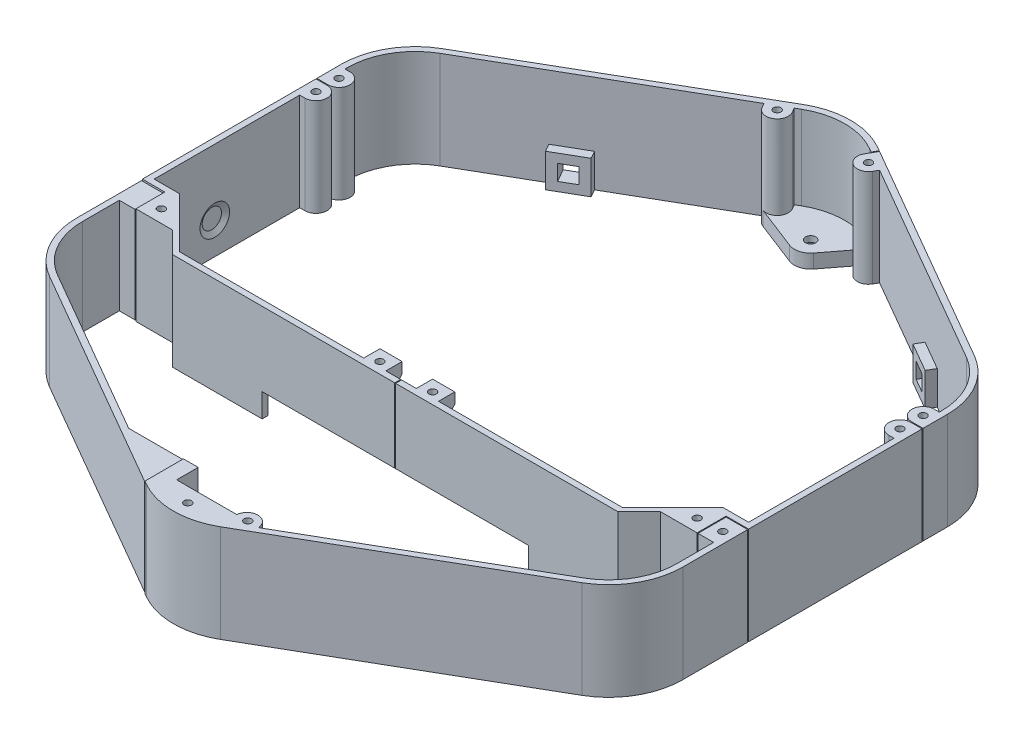
from build123d import *

# Parameters (mm, degrees)
BOSS_EXTRU_1_DEPTH       = 33
CONG_8_R                 = 25
ENL_V_MAT_EXTRU_8_DEPTH  = 158.17203288
ESQUISSE32_R             = 5
ENL_V_MAT_EXTRU_17_DEPTH = 1
CHANFREIN1_SIZE2         = 1.732050808
CHANFREIN1_SIZE          = 1
CHANFREIN2_SIZE2         = 1.732050808
CHANFREIN2_SIZE          = 1
BOSS_EXTRU_2_DEPTH       = 33
BOSS_EXTRU_3_START       = -33
ESQUISSE34_W             = 18.5
ESQUISSE34_H             = 9.8
BOSS_EXTRU_3_DEPTH       = 33
ESQUISSE35_W             = 0.3
ESQUISSE35_H             = 13
ENL_V_MAT_EXTRU_22_DEPTH = 158.17203288
ESQUISSE36_W             = 17.253866082
ESQUISSE36_H             = 7.3
ENL_V_MAT_EXTRU_23_DEPTH = 158.17203288
ENL_V_START              = -15.2
ESQUISSE37_W             = 5.5
ESQUISSE37_H             = 5.5
ENL_V_MAT_EXTRU_24_DEPTH = 20.5
ENL_V_START_2            = -5.3
ESQUISSE38_W             = 5.5
ESQUISSE38_H             = 5.5
ENL_V_MAT_EXTRU_25_DEPTH = 10.6
ESQUISSE39_W             = 228.978583448
ESQUISSE39_H             = 0.3
ENL_V_MAT_EXTRU_26_DEPTH = 158.17203288
ENL_V_MAT_EXTRU_27_DEPTH = 158.17203288
BOSS_EXTRU_4_DEPTH       = 33
ENL_V_MAT_EXTRU_28_DEPTH = 158.17203288
BOSS_EXTRU_5_DEPTH       = 4.7
ENL_V_MAT_EXTRU_29_DEPTH = 2.7
ESQUISSE45_R             = 1.75
ENL_V_MAT_EXTRU_30_DEPTH = 157.627385599
CONG_10_R                = 8
ESQUISSE46_W             = 90
ESQUISSE46_H             = 8
ENL_V_MAT_EXTRU_31_DEPTH = 2
ESQUISSE47_W             = 0.3
ESQUISSE47_H             = 2
ESQUISSE47_W_2           = 205
ESQUISSE47_H_2           = 0.3
ENL_V_MAT_EXTRU_32_DEPTH = 158.17203288
ENL_V_MAT_EXTRU_33_DEPTH = 158.17203288
BOSS_EXTRU_6_START       = -33
ESQUISSE49_R             = 3.75
ESQUISSE49_R_2           = 1.25
BOSS_EXTRU_6_DEPTH       = 33
BOSS_EXTRU_7_DEPTH       = 4.7
ESQUISSE51_R             = 1.25
ENL_V_MAT_EXTRU_34_DEPTH = 158.17203288
ESQUISSE52_W             = 7.5
ESQUISSE52_H             = 7.5
BOSS_EXTRU_8_DEPTH       = 25
ESQUISSE53_R             = 1.25
ENL_V_MAT_EXTRU_35_DEPTH = 158.17203288
ENL_V_MAT_EXTRU_36_REACH = 167.699
BOSS_EXTRU_9_DEPTH       = 4.7
ESQUISSE56_W             = 5.3
ESQUISSE56_H             = 5.3
ENL_V_MAT_EXTRU_37_DEPTH = 13
ESQUISSE57_W             = 11.3
ESQUISSE57_H             = 11.3
ESQUISSE57_W_2           = 5.3
ESQUISSE57_H_2           = 5.3
BOSS_EXTRU_10_DEPTH      = 3
ESQUISSE58_W             = 5.3
ESQUISSE58_H             = 5.3
ENL_V_MAT_EXTRU_38_DEPTH = 2
ESQUISSE59_W             = 11.3
ESQUISSE59_H             = 11.3
ESQUISSE59_W_2           = 5.3
ESQUISSE59_H_2           = 5.3
BOSS_EXTRU_11_DEPTH      = 3


with BuildPart() as part:
    # Esquisse1 → Boss.-Extru.1 (new body)
    with BuildSketch(Plane(origin=(0, 0, 0), x_dir=(1, 0, 0), z_dir=(0, 1, 0))):
        Polygon((-102.5, 59.178402592), (-102.5, -59.178402592), (0, -118.356805184), (102.5, -59.178402592), (102.5, 59.178402592), (0, 118.356805184), align=None)
    extrude(amount=BOSS_EXTRU_1_DEPTH)

    # Congé8
    cong_8_edges = [part.edges().sort_by_distance(p)[0] for p in [
        (0, 16.5, -118.356805184),
        (102.5, 16.5, -59.178402592),
        (102.5, 16.5, 59.178402592),
        (0, 16.5, 118.356805184),
        (-102.5, 16.5, 59.178402592),
        (-102.5, 16.5, -59.178402592),
    ]]
    fillet(cong_8_edges, radius=CONG_8_R)

    # Esquisse22 → Enlèv. mat.-Extru.8 (cut, through all)
    with BuildSketch(Plane(origin=(0, 33, 0), x_dir=(1, 0, 0), z_dir=(0, 1, 0))):
        with BuildLine():
            Line((89, 64.663230149), (11.5, 109.407876011))
            ThreePointArc((11.5, 109.407876011), (0, 112.489291724), (-11.5, 109.407876011))
            Line((-11.5, 109.407876011), (-89, 64.663230149))
            ThreePointArc((-89, 64.663230149), (-97.418584287, 56.244645862), (-100.5, 44.744645862))
            Line((-100.5, 44.744645862), (-100.5, -44.744645862))
            ThreePointArc((-100.5, -44.744645862), (-97.418584287, -56.244645862), (-89, -64.663230149))
            Line((-89, -64.663230149), (-11.5, -109.407876011))
            ThreePointArc((-11.5, -109.407876011), (0, -112.489291724), (11.5, -109.407876011))
            Line((11.5, -109.407876011), (89, -64.663230149))
            ThreePointArc((89, -64.663230149), (97.418584287, -56.244645862), (100.5, -44.744645862))
            Line((100.5, -44.744645862), (100.5, 44.744645862))
            ThreePointArc((100.5, 44.744645862), (97.418584287, 56.244645862), (89, 64.663230149))
        make_face()
    extrude(amount=-ENL_V_MAT_EXTRU_8_DEPTH, mode=Mode.SUBTRACT)

    # Esquisse32 → Enlèv. mat.-Extru.17 (cut)
    with BuildSketch(Plane(origin=(-100.5, 0, 0), x_dir=(0, 0, -1), z_dir=(1, 0, 0))):
        with Locations((0, 10.7)):
            Circle(ESQUISSE32_R)
    enl_v_mat_extru_17 = extrude(amount=-ENL_V_MAT_EXTRU_17_DEPTH, mode=Mode.SUBTRACT)

    # Chanfrein1
    chanfrein1_edges = [part.edges().sort_by_distance(p)[0] for p in [
        (-101.5, 10.7, 5),
    ]]
    chanfrein1_side = [part.faces().sort_by_distance(p)[0] for p in [
        (-101.48, 10.7, 5),
    ]]
    chamfer(chanfrein1_edges, length=CHANFREIN1_SIZE - 0.0001, length2=CHANFREIN1_SIZE2 - 0.0001, reference=chanfrein1_side[0])  # a hair under: the kernel refuses the full size

    # Symétrie8: Enlèv. mat.-Extru.17 across plane
    add(enl_v_mat_extru_17.mirror(Plane(origin=(0, 0, 0), x_dir=(0, 0, 1), z_dir=(1, 0, 0))), mode=Mode.SUBTRACT)

    # Chanfrein2
    chanfrein2_edges = [part.edges().sort_by_distance(p)[0] for p in [
        (101.5, 10.7, 5),
    ]]
    chanfrein2_side = [part.faces().sort_by_distance(p)[0] for p in [
        (101.48, 10.7, 5),
    ]]
    chamfer(chanfrein2_edges, length=CHANFREIN2_SIZE - 0.0001, length2=CHANFREIN2_SIZE2 - 0.0001, reference=chanfrein2_side[0])  # a hair under: the kernel refuses the full size

    # Esquisse33 → Boss.-Extru.2 (add)
    with BuildSketch(Plane.XZ):
        Polygon((-100.5, 20.5), (-80, 20.5), (-80, 32.5), (-75, 37.5), (75, 37.5), (80, 32.5), (80, 20.5), (100.5, 20.5), (100.5, 22.5), (82, 22.5), (82, 32.828427125), (75.328427125, 39.5), (-75.328427125, 39.5), (-82, 32.828427125), (-82, 22.5), (-100.5, 22.5), align=None)
    extrude(amount=-BOSS_EXTRU_2_DEPTH)

    # Esquisse34 → Boss.-Extru.3 (add)
    with BuildSketch(Plane.XZ.offset(BOSS_EXTRU_3_START)):
        with Locations((-91.25, 27.4)):
            Rectangle(ESQUISSE34_W, ESQUISSE34_H)
        with BuildLine():
            Line((11.5, 109.407876011), (32.143593539, 97.489291724))
            Line((32.143593539, 97.489291724), (-32.143593539, 97.489291724))
            Line((-32.143593539, 97.489291724), (-11.5, 109.407876011))
            ThreePointArc((-11.5, 109.407876011), (0, 112.489291724), (11.5, 109.407876011))
        make_face()
        with Locations((91.25, 27.4)):
            Rectangle(ESQUISSE34_W, ESQUISSE34_H)
    extrude(amount=BOSS_EXTRU_3_DEPTH)

    # Esquisse35 → Enlèv. mat.-Extru.22 (cut, through all)
    with BuildSketch(Plane(origin=(0, 0, 0), x_dir=(1, 0, 0), z_dir=(0, 1, 0))):
        Polygon((-102.5, -22.5), (-94.9, -22.5), (-94.9, -32.3), (-95.2, -32.3), (-95.2, -22.8), (-102.5, -22.8), align=None)
        with Locations((-13.776933041, -103.989291724)):
            Rectangle(ESQUISSE35_W, ESQUISSE35_H)
    extrude(amount=ENL_V_MAT_EXTRU_22_DEPTH, mode=Mode.SUBTRACT)


with BuildPart() as enl_v_mat_extru_22_piece_1:
    # of the separate pieces the step leaves, piece 1, a body of its own (enl_v_mat_extru_22_pieces)
    add(part.part.solids().sort_by_distance((100.5001, 10.7, -5))[0])

    # Esquisse36 → Enlèv. mat.-Extru.23 (cut, through all)
    with BuildSketch(Plane.XZ):
        with Locations((0, 101.139291724)):
            Rectangle(ESQUISSE36_W, ESQUISSE36_H)
    extrude(amount=-ENL_V_MAT_EXTRU_23_DEPTH, mode=Mode.SUBTRACT)


with BuildPart() as enl_v_mat_extru_22_piece_2:
    # of the separate pieces the step leaves, piece 2, a body of its own (enl_v_mat_extru_22_pieces)
    add(part.part.solids().sort_by_distance((-102.5, 33, 22.8))[0])


with BuildPart() as enl_v_mat_extru_24_tool:
    # Esquisse37 → Enlèv. mat.-Extru.24 (new body)
    with BuildSketch(Plane.ZY.offset(95.2).offset(ENL_V_START)):
        with Locations((27.55, 16.5)):
            Rectangle(ESQUISSE37_W, ESQUISSE37_H)
    extrude(amount=ENL_V_MAT_EXTRU_24_DEPTH)


with BuildPart() as enl_v_mat_extru_22_piece_1_1:
    add(enl_v_mat_extru_22_piece_1.part)

    # Enlèv. mat.-Extru.24: cut by enl_v_mat_extru_24_tool
    add(enl_v_mat_extru_24_tool.part, mode=Mode.SUBTRACT)


with BuildPart() as enl_v_mat_extru_22_piece_2_1:
    add(enl_v_mat_extru_22_piece_2.part)

    # Enlèv. mat.-Extru.24: cut by enl_v_mat_extru_24_tool
    add(enl_v_mat_extru_24_tool.part, mode=Mode.SUBTRACT)


with BuildPart() as enl_v_mat_extru_25_tool:
    # Esquisse38 → Enlèv. mat.-Extru.25 (new body)
    with BuildSketch(Plane(origin=(-13.926933041, 0, 0), x_dir=(0, 0, -1), z_dir=(1, 0, 0)).offset(ENL_V_START_2)):
        with Locations((-102.039291724, 16.5)):
            Rectangle(ESQUISSE38_W, ESQUISSE38_H)
    extrude(amount=ENL_V_MAT_EXTRU_25_DEPTH)


with BuildPart() as enl_v_mat_extru_22_piece_1_2:
    add(enl_v_mat_extru_22_piece_1_1.part)

    # Enlèv. mat.-Extru.25: cut by enl_v_mat_extru_25_tool
    add(enl_v_mat_extru_25_tool.part, mode=Mode.SUBTRACT)

    # Esquisse40 → Enlèv. mat.-Extru.27 (cut, through all)
    with BuildSketch(Plane(origin=(0, 33, 0), x_dir=(1, 0, 0), z_dir=(0, 1, 0))):
        Polygon((32.143593539, -97.489291724), (19.499622644, -104.789291724), (8.626933041, -104.789291724), (8.626933041, -97.489291724), align=None)
    extrude(amount=-ENL_V_MAT_EXTRU_27_DEPTH, mode=Mode.SUBTRACT)

    # Esquisse41 → Boss.-Extru.4 (add)
    with BuildSketch(Plane(origin=(0, 33, 0), x_dir=(1, 0, 0), z_dir=(0, 1, 0))):
        Polygon((-82, -32.828427125), (-82.528427125, -32.3), (-82, -32.3), align=None)
        Polygon((82, -32.3), (82, -32.828427125), (82.528427125, -32.3), align=None)
    extrude(amount=-BOSS_EXTRU_4_DEPTH)

    # Esquisse42 → Enlèv. mat.-Extru.28 (cut, through all)
    with BuildSketch(Plane(origin=(0, 33, 0), x_dir=(1, 0, 0), z_dir=(0, 1, 0))):
        Polygon((-80, -32.5), (-92, -20.5), (-80, -20.5), align=None)
        Polygon((80, -20.5), (80, -32.5), (92, -20.5), align=None)
    extrude(amount=-ENL_V_MAT_EXTRU_28_DEPTH, mode=Mode.SUBTRACT)

    # Esquisse43 → Boss.-Extru.5 (add)
    with BuildSketch(Plane(origin=(0, 0, 0), x_dir=(-1, 0, 0), z_dir=(0, -1, 0))):
        with BuildLine():
            Line((-8.688641212, -104.789291724), (8.626933041, -104.789291724))
            Line((8.626933041, -104.789291724), (8.626933041, -97.489291724))
            Line((8.626933041, -97.489291724), (1.335205168, -95.664531215))
            ThreePointArc((1.335205168, -95.664531215), (-2.103871642, -95.918295157), (-4.715890745, -98.169739503))
            Line((-4.715890745, -98.169739503), (-8.688641212, -104.789291724))
        make_face()
        with BuildLine():
            Line((-4.363443372, 97.65181214), (-12.805729024, 108.654013008))
            Line((-12.805729024, 108.654013008), (-11.5, 109.407876011))
            ThreePointArc((-11.5, 109.407876011), (0, 112.489291724), (11.5, 109.407876011))
            Line((11.5, 109.407876011), (12.805729024, 108.654013008))
            Line((12.805729024, 108.654013008), (4.363443372, 97.65181214))
            ThreePointArc((4.363443372, 97.65181214), (0, 95.5), (-4.363443372, 97.65181214))
        make_face()
    extrude(amount=-BOSS_EXTRU_5_DEPTH)

    # Esquisse44 → Enlèv. mat.-Extru.29 (cut)
    with BuildSketch(Plane.XZ):
        Polygon((-1.674315781, -103.9), (1.674315781, -103.9), (3.348631561, -101), (1.674315781, -98.1), (-1.674315781, -98.1), (-3.348631561, -101), align=None)
        Polygon((-3.348631561, 101), (-1.674315781, 103.9), (1.674315781, 103.9), (3.348631561, 101), (1.674315781, 98.1), (-1.674315781, 98.1), align=None)
    extrude(amount=-ENL_V_MAT_EXTRU_29_DEPTH, mode=Mode.SUBTRACT)

    # Esquisse45 → Enlèv. mat.-Extru.30 (cut, through all)
    with BuildSketch(Plane.XZ.offset(-2.7)):
        with Locations(Location((0, -101, 0), (0, 0, 270))):
            Circle(ESQUISSE45_R)
        with Locations(Location((0, 101, 0), (0, 0, 270))):
            Circle(ESQUISSE45_R)
    extrude(amount=-ENL_V_MAT_EXTRU_30_DEPTH, mode=Mode.SUBTRACT)

    # Congé10
    cong_10_edges = [enl_v_mat_extru_22_piece_1_2.edges().sort_by_distance(p)[0] for p in [
        (-8.626933041, 2.35, 97.489291724),
        (8.688641212, 2.35, 104.789291724),
    ]]
    fillet(cong_10_edges, radius=CONG_10_R)

    # Esquisse46 → Enlèv. mat.-Extru.31 (cut)
    with BuildSketch(Plane(origin=(0, 0, 37.5), x_dir=(-1, 0, 0), z_dir=(0, 0, -1))):
        with Locations((0, 4)):
            Rectangle(ESQUISSE46_W, ESQUISSE46_H)
    extrude(amount=-ENL_V_MAT_EXTRU_31_DEPTH, mode=Mode.SUBTRACT)

    # Esquisse47 → Enlèv. mat.-Extru.32 (cut, through all)
    with BuildSketch(Plane(origin=(0, 33, 0), x_dir=(1, 0, 0), z_dir=(0, 1, 0))):
        Polygon((12.805729024, 108.654013008), (13.805729024, 110.386063815), (14.065536645, 110.236063815), (13.065536645, 108.504013008), align=None)
        with Locations((0, -38.5)):
            Rectangle(ESQUISSE47_W, ESQUISSE47_H)
        with Locations((0, 36.35)):
            Rectangle(ESQUISSE47_W_2, ESQUISSE47_H_2)
    extrude(amount=-ENL_V_MAT_EXTRU_32_DEPTH, mode=Mode.SUBTRACT)


with BuildPart() as enl_v_mat_extru_22_piece_2_2:
    add(enl_v_mat_extru_22_piece_2_1.part)

    # Enlèv. mat.-Extru.25: cut by enl_v_mat_extru_25_tool
    add(enl_v_mat_extru_25_tool.part, mode=Mode.SUBTRACT)

    # Esquisse39 → Enlèv. mat.-Extru.26 (cut, through all)
    with BuildSketch(Plane(origin=(0, 0, 0), x_dir=(0, 0, -1), z_dir=(1, 0, 0))):
        with Locations((0, 32.85)):
            Rectangle(ESQUISSE39_W, ESQUISSE39_H)
        with Locations((0, 0.15)):
            Rectangle(ESQUISSE39_W, ESQUISSE39_H)
    extrude(amount=-ENL_V_MAT_EXTRU_26_DEPTH, mode=Mode.SUBTRACT)


with BuildPart() as enl_v_mat_extru_32_piece_1:
    # of the separate pieces the step leaves, piece 1, a body of its own (enl_v_mat_extru_32_pieces)
    add(enl_v_mat_extru_22_piece_1_2.part.solids().sort_by_distance((-9.612736383, 0, 97.489291724))[0])

    # Esquisse48 → Enlèv. mat.-Extru.33 (cut, through all)
    with BuildSketch(Plane(origin=(0, 33, 0), x_dir=(1, 0, 0), z_dir=(0, 1, 0))):
        Polygon((94.9, -32.3), (94.9, -22.5), (102.5, -22.5), (102.5, -22.8), (95.2, -22.8), (95.2, -32.3), align=None)
    extrude(amount=-ENL_V_MAT_EXTRU_33_DEPTH, mode=Mode.SUBTRACT)


with BuildPart() as enl_v_mat_extru_32_piece_2:
    # of the separate pieces the step leaves, piece 2, a body of its own (enl_v_mat_extru_32_pieces)
    add(enl_v_mat_extru_22_piece_1_2.part.solids().sort_by_distance((-0.15, 33, 39.5))[0])



with BuildPart() as enl_v_mat_extru_32_piece_3:
    # of the separate pieces the step leaves, piece 3, a body of its own (enl_v_mat_extru_32_pieces)
    add(enl_v_mat_extru_22_piece_1_2.part.solids().sort_by_distance((12.805729024, 0, -108.654013008))[0])


with BuildPart() as enl_v_mat_extru_32_piece_4:
    # of the separate pieces the step leaves, piece 4, a body of its own (enl_v_mat_extru_32_pieces)
    add(enl_v_mat_extru_22_piece_1_2.part.solids().sort_by_distance((100.5, 0, -36.5))[0])


with BuildPart() as enl_v_mat_extru_33_piece_1:
    # of the separate pieces the step leaves, piece 1, a body of its own (enl_v_mat_extru_33_pieces)
    add(enl_v_mat_extru_32_piece_1.part.solids().sort_by_distance((-9.612736383, 0, 97.489291724))[0])


with BuildPart() as enl_v_mat_extru_33_piece_2:
    # of the separate pieces the step leaves, piece 2, a body of its own (enl_v_mat_extru_33_pieces)
    add(enl_v_mat_extru_32_piece_1.part.solids().sort_by_distance((94.9, 0, 22.5))[0])


with BuildPart() as enl_v_mat_extru_32_piece_2_1:
    add(enl_v_mat_extru_32_piece_2.part)

    add(enl_v_mat_extru_32_piece_3.part)  # Boss.-Extru.6 merges Enlèv. mat.-Extru.32 piece 3

    add(enl_v_mat_extru_32_piece_4.part)  # Boss.-Extru.6 merges Enlèv. mat.-Extru.32 piece 4

    add(enl_v_mat_extru_33_piece_1.part)  # Boss.-Extru.6 merges Enlèv. mat.-Extru.33 piece 1

    add(enl_v_mat_extru_33_piece_2.part)  # Boss.-Extru.6 merges Enlèv. mat.-Extru.33 piece 2
    # Esquisse49 → Boss.-Extru.6 (add)
    # profile 1 of 7: a face of its own
    with BuildSketch(Plane(origin=(0, 33, 0), x_dir=(1, 0, 0), z_dir=(0, 1, 0)).offset(BOSS_EXTRU_6_START)):
        with Locations((15.43813191, -105.113468551)):
            Circle(ESQUISSE49_R)
    # profile 2 of 7: a face of its own
    with BuildSketch(Plane(origin=(0, 33, 0), x_dir=(1, 0, 0), z_dir=(0, 1, 0)).offset(BOSS_EXTRU_6_START)):
        with BuildLine():
            Line((100.5, 36.5), (98.75, 36.5))
            ThreePointArc((98.75, 36.5), (95, 40.25), (98.75, 44))
            Line((98.75, 44), (100.5, 44))
            Line((100.5, 44), (100.5, 36.5))
        make_face()
        with Locations(Location((98.75, 40.25, 0), (0, 0, 270))):
            Circle(ESQUISSE49_R_2, mode=Mode.SUBTRACT)
    # profile 3 of 7: a face of its own
    with BuildSketch(Plane(origin=(0, 33, 0), x_dir=(1, 0, 0), z_dir=(0, 1, 0)).offset(BOSS_EXTRU_6_START)):
        with BuildLine():
            Line((19.560727174, 104.754013008), (18.685727174, 103.238468551))
            ThreePointArc((18.685727174, 103.238468551), (13.56313191, 101.865873287), (12.190536645, 106.988468551))
            Line((12.190536645, 106.988468551), (13.065536645, 108.504013008))
            Line((13.065536645, 108.504013008), (19.560727174, 104.754013008))
        make_face()
        with Locations(Location((15.43813191, 105.113468551, 0), (0, 0, 270))):
            Circle(ESQUISSE49_R_2, mode=Mode.SUBTRACT)
    # profile 4 of 7: a face of its own
    with BuildSketch(Plane(origin=(0, 33, 0), x_dir=(1, 0, 0), z_dir=(0, 1, 0)).offset(BOSS_EXTRU_6_START)):
        with BuildLine():
            Line((100.5, 36.2), (98.75, 36.2))
            ThreePointArc((98.75, 36.2), (95, 32.45), (98.75, 28.7))
            Line((98.75, 28.7), (100.5, 28.7))
            Line((100.5, 28.7), (100.5, 36.2))
        make_face()
        with Locations(Location((98.75, 32.45, 0), (0, 0, 270))):
            Circle(ESQUISSE49_R_2, mode=Mode.SUBTRACT)
    # profile 5 of 7: a face of its own
    with BuildSketch(Plane(origin=(0, 33, 0), x_dir=(1, 0, 0), z_dir=(0, 1, 0)).offset(BOSS_EXTRU_6_START)):
        with BuildLine():
            Line((-100.5, 28.7), (-100.5, 36.2))
            Line((-100.5, 36.2), (-98.75, 36.2))
            ThreePointArc((-98.75, 36.2), (-95, 32.45), (-98.75, 28.7))
            Line((-98.75, 28.7), (-100.5, 28.7))
        make_face()
        with Locations(Location((-98.75, 32.45, 0), (0, 0, 270))):
            Circle(ESQUISSE49_R_2, mode=Mode.SUBTRACT)
    # profile 6 of 7: a face of its own
    with BuildSketch(Plane(origin=(0, 33, 0), x_dir=(1, 0, 0), z_dir=(0, 1, 0)).offset(BOSS_EXTRU_6_START)):
        with BuildLine():
            Line((-100.5, 44), (-100.5, 36.5))
            Line((-100.5, 36.5), (-98.75, 36.5))
            ThreePointArc((-98.75, 36.5), (-95, 40.25), (-98.75, 44))
            Line((-98.75, 44), (-100.5, 44))
        make_face()
        with Locations(Location((-98.75, 40.25, 0), (0, 0, 270))):
            Circle(ESQUISSE49_R_2, mode=Mode.SUBTRACT)
    # profile 7 of 7: a face of its own
    with BuildSketch(Plane(origin=(0, 33, 0), x_dir=(1, 0, 0), z_dir=(0, 1, 0)).offset(BOSS_EXTRU_6_START)):
        with BuildLine():
            Line((-19.560727174, 104.754013008), (-13.065536645, 108.504013008))
            Line((-13.065536645, 108.504013008), (-12.190536645, 106.988468551))
            ThreePointArc((-12.190536645, 106.988468551), (-13.56313191, 101.865873287), (-18.685727174, 103.238468551))
            Line((-18.685727174, 103.238468551), (-19.560727174, 104.754013008))
        make_face()
        with Locations(Location((-15.43813191, 105.113468551, 0), (0, 0, 270))):
            Circle(ESQUISSE49_R_2, mode=Mode.SUBTRACT)
    extrude(amount=BOSS_EXTRU_6_DEPTH)

    # Esquisse50 → Boss.-Extru.7 (add)
    with BuildSketch(Plane(origin=(0, 4.7, 0), x_dir=(1, 0, 0), z_dir=(0, 1, 0))):
        with BuildLine():
            Line((-12.190536645, 106.988468551), (-13.065536645, 108.504013008))
            Line((-13.065536645, 108.504013008), (-12.805729024, 108.654013008))
            Line((-12.805729024, 108.654013008), (-4.363443372, 97.65181214))
            ThreePointArc((-4.363443372, 97.65181214), (-3.298787259, 96.599090705), (-1.989670285, 95.8725043))
            Line((-1.989670285, 95.8725043), (-16.794725285, 101.617448755))
            ThreePointArc((-16.794725285, 101.617448755), (-12.591039455, 102.672861136), (-12.190536645, 106.988468551))
        make_face()
    extrude(amount=-BOSS_EXTRU_7_DEPTH)

    # Esquisse51 → Enlèv. mat.-Extru.34 (cut, through all)
    with BuildSketch(Plane(origin=(0, 33, 0), x_dir=(1, 0, 0), z_dir=(0, 1, 0))):
        with Locations(Location((15.43813191, -104.789291724, 0), (0, 0, 270))):
            Circle(ESQUISSE51_R)
        with Locations(Location((98.85, -27.55, 0), (0, 0, 270))):
            Circle(ESQUISSE51_R)
        with Locations(Location((90.594469683, -27.994469683, 0), (0, 0, 270))):
            Circle(ESQUISSE51_R)
        with Locations(Location((-90.594469683, -27.994469683, 0), (0, 0, 90))):
            Circle(ESQUISSE51_R)
        with Locations(Location((0, -109.639291724, 0), (0, 0, 270))):
            Circle(ESQUISSE51_R)
    extrude(amount=-ENL_V_MAT_EXTRU_34_DEPTH, mode=Mode.SUBTRACT)

    # Esquisse52 → Boss.-Extru.8 (add)
    with BuildSketch(Plane(origin=(0, 33, 0), x_dir=(1, 0, 0), z_dir=(0, 1, 0))):
        with Locations((-8.9, -35.75)):
            Rectangle(ESQUISSE52_W, ESQUISSE52_H)
        with Locations((8.9, -35.75)):
            Rectangle(ESQUISSE52_W, ESQUISSE52_H)
    extrude(amount=-BOSS_EXTRU_8_DEPTH)

    # Esquisse53 → Enlèv. mat.-Extru.35 (cut, through all)
    with BuildSketch(Plane(origin=(0, 33, 0), x_dir=(1, 0, 0), z_dir=(0, 1, 0))):
        with Locations(Location((-8.9, -35.75, 0), (0, 0, 270))):
            Circle(ESQUISSE53_R)
        with Locations(Location((8.9, -35.75, 0), (0, 0, 270))):
            Circle(ESQUISSE53_R)
    extrude(amount=-ENL_V_MAT_EXTRU_35_DEPTH, mode=Mode.SUBTRACT)

    # Enlèv. mat.-Extru.36: up to this face of the body (flat: up to its plane)
    enl_v_mat_extru_36_end = Plane(enl_v_mat_extru_32_piece_2_1.part.faces().sort_by_distance((12.65, 20.5, 34.75))[0])
    # Esquisse54 → Enlèv. mat.-Extru.36 (cut, up to the picked face)
    with BuildSketch(Plane.ZY.offset(12.65), mode=Mode.PRIVATE) as enl_v_mat_extru_36_sk1:
        with BuildLine():
            Line((34.680307126, 25.760453761), (37.5, 19.979226629))
            Line((37.5, 19.979226629), (37.5, 0))
            Line((37.5, 0), (11.89477857, 0))
            Line((11.89477857, 0), (11.89477857, 20.5))
            ThreePointArc((11.89477857, 20.5), (21.195365918, 32.192440777), (34.680307126, 25.760453761))
        make_face()
    enl_v_mat_extru_36_tool1 = split(extrude(enl_v_mat_extru_36_sk1.sketch, amount=-ENL_V_MAT_EXTRU_36_REACH, mode=Mode.PRIVATE), bisect_by=enl_v_mat_extru_36_end, keep=Keep.BOTH, mode=Mode.PRIVATE)
    add(enl_v_mat_extru_36_tool1.solids().sort_by(Axis((-12.65, 14.892678, 24.492585), (1, 0, 0)))[0], mode=Mode.SUBTRACT)

    # Esquisse55 → Boss.-Extru.9 (add)
    with BuildSketch(Plane.XZ):
        with BuildLine():
            Line((1.989670285, 95.8725043), (16.794725285, 101.617448755))
            ThreePointArc((16.794725285, 101.617448755), (13.516526004, 101.893230867), (11.717214619, 104.647341404))
            ThreePointArc((11.717214619, 104.647341404), (8.638152536, 103.34893877), (6.358088877, 100.906034265))
            Line((6.358088877, 100.906034265), (4.715890745, 98.169739503))
            ThreePointArc((4.715890745, 98.169739503), (3.544073867, 96.794106466), (1.989670285, 95.8725043))
        make_face()
    extrude(amount=-BOSS_EXTRU_9_DEPTH)

    # Esquisse56 → Enlèv. mat.-Extru.37 (cut)
    with BuildSketch(Plane(origin=(-51.25, 0, -88.767603888), x_dir=(-0.8660254037844386, 0, 0.5000000000000001), z_dir=(-0.5000000000000001, 0, -0.8660254037844386))):
        with Locations((12.173175892, 5.65)):
            Rectangle(ESQUISSE56_W, ESQUISSE56_H)
    extrude(amount=-ENL_V_MAT_EXTRU_37_DEPTH, mode=Mode.SUBTRACT)

    # Esquisse57 → Boss.-Extru.10 (add)
    with BuildSketch(Plane(origin=(-50.25, 0, -87.03555308), x_dir=(0.8660254037844386, 0, -0.5000000000000002), z_dir=(0.5000000000000002, 0, 0.8660254037844386))):
        with Locations((-12.173175892, 5.65)):
            Rectangle(ESQUISSE57_W, ESQUISSE57_H)
        with Locations((-12.173175892, 5.65)):
            Rectangle(ESQUISSE57_W_2, ESQUISSE57_H_2, mode=Mode.SUBTRACT)
    extrude(amount=BOSS_EXTRU_10_DEPTH)

    # Esquisse58 → Enlèv. mat.-Extru.38 (cut)
    with BuildSketch(Plane(origin=(51.25, 0, -88.767603888), x_dir=(-0.8660254037844387, 0, -0.4999999999999999), z_dir=(0.4999999999999999, 0, -0.8660254037844387))):
        with Locations((-12.173175892, 5.65)):
            Rectangle(ESQUISSE58_W, ESQUISSE58_H)
    extrude(amount=-ENL_V_MAT_EXTRU_38_DEPTH, mode=Mode.SUBTRACT)

    # Esquisse59 → Boss.-Extru.11 (add)
    with BuildSketch(Plane(origin=(50.25, 0, -87.03555308), x_dir=(0.8660254037844388, 0, 0.4999999999999997), z_dir=(-0.49999999999999983, 0, 0.8660254037844389))):
        with Locations((12.173175892, 5.65)):
            Rectangle(ESQUISSE59_W, ESQUISSE59_H)
        with Locations((12.173175892, 5.65)):
            Rectangle(ESQUISSE59_W_2, ESQUISSE59_H_2, mode=Mode.SUBTRACT)
    extrude(amount=BOSS_EXTRU_11_DEPTH)


solid = Compound([enl_v_mat_extru_22_piece_2_2.part, enl_v_mat_extru_32_piece_2_1.part])
